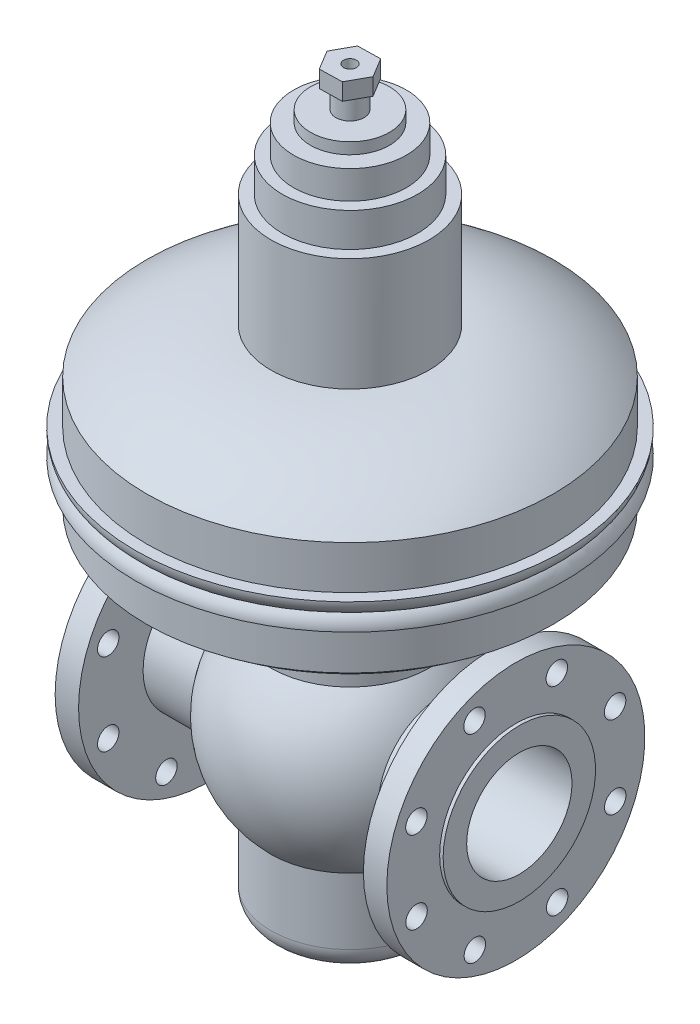
from build123d import *

# Parameters (mm, degrees)
SKETCH1_R                   = 57.15
BASE_EXTRUDE_DEPTH          = 150
BOSS_EXTRUDE1_DEPTH         = 400
BOSS_EXTRUDE1_DEPTH_BACK    = 150
SKETCH2_R                   = 70
FILLET1_R                   = 20
SHELL1_START                = -150
SHELL1_OUTLINE_R            = 46.65
SHELL1_DEPTH                = 300
SKETCH6_R                   = 60
BOSS_EXTRUDE2_DEPTH         = 30
SKETCH7_R                   = 50
BOSS_EXTRUDE3_DEPTH         = 25
SKETCH8_R                   = 35
BOSS_EXTRUDE4_DEPTH         = 10
SKETCH9_R                   = 12.5
BOSS_EXTRUDE5_DEPTH         = 35
BOSS_EXTRUDE6_DEPTH         = 15
CUT_EXTRUDE1_REACH          = 634.14
SKETCH14_R                  = 9.5
CIRPATTERN1_COUNT           = 8
CUT_EXTRUDE2_REACH          = 634.14
SKETCH15_R                  = 9.5
CIRPATTERN2_COUNT           = 8
F_1_2_20_TAPPED_HOLE1_D     = 11.50874
F_1_2_20_TAPPED_HOLE1_DEPTH = 31.75
F_1_2_20_TAPPED_HOLE1_TIP   = 3.45757432


with BuildPart() as part:
    # Sketch1 → Base-Extrude (new, symmetric)
    with BuildSketch(Plane(origin=(0, 0, 0), x_dir=(0, 0, -1), z_dir=(1, 0, 0))):
        Circle(SKETCH1_R)
    extrude(amount=BASE_EXTRUDE_DEPTH, both=True)

    # Sketch2 → Boss-Extrude1 (add, two sides: drawn at the far end of the back side and taken through both)
    with BuildSketch(Plane(origin=(0, 0, 0), x_dir=(1, 0, 0), z_dir=(0, 1, 0)).offset(-BOSS_EXTRUDE1_DEPTH_BACK)):
        with Locations(Location((0, 0, 0), (0, 0, 270))):
            Circle(SKETCH2_R)
    extrude(amount=BOSS_EXTRUDE1_DEPTH + BOSS_EXTRUDE1_DEPTH_BACK)

    # Sketch3 → Boss-Revolve1 (revolve)
    with BuildSketch(Plane.XY):
        with BuildLine():
            Line((0, -100), (0, 100))
            ThreePointArc((0, 100), (100, 0), (0, -100))
        make_face()
    revolve(axis=Axis((0, -115.862970753, 0), (0, 1, 0)))

    # Fillet1
    fillet1_edges = [part.edges().sort_by_distance(p)[0] for p in [
        (0, -150, -70),
    ]]
    fillet(fillet1_edges, radius=FILLET1_R)

    # Shell1: read off the stored shape, not the designer's step
    # Shell1 outline → Shell1 (cut)
    with BuildSketch(Plane.YZ.offset(SHELL1_START)):
        Circle(SHELL1_OUTLINE_R)
    extrude(amount=SHELL1_DEPTH, mode=Mode.SUBTRACT)

    # Shell1 2 outline → Shell1 2 (revolve, cut)
    with BuildSketch(Plane.XY):
        with BuildLine():
            Line((59.499999977, 66.858058621), (59.5, 389.5))
            Line((59.5, 389.5), (0, 389.5))
            Line((0, 389.5), (0, -139.5))
            Line((0, -139.5), (50, -139.5))
            ThreePointArc((50, -139.5), (56.717514421, -136.717514421), (59.5, -130))
            Line((59.5, -130), (59.499999977, -66.858058621))
            ThreePointArc((59.499999977, -66.858058621), (89.5, 0), (59.499999977, 66.858058621))
        make_face()
    revolve(axis=Axis((0, 0, 0), (0, 1, 0)), mode=Mode.SUBTRACT)

    # Sketch4 → Boss-Revolve2 (revolve)
    with BuildSketch(Plane.XY, mode=Mode.PRIVATE) as boss_revolve2_sk:
        with BuildLine():
            Line((70, 210), (180, 210))
            Line((180, 210), (180, 160))
            ThreePointArc((180, 160), (128.523499554, 130.310376228), (70, 120))
            Line((70, 120), (70, 210))
        make_face()
    revolve(boss_revolve2_sk.sketch.rotate(Axis((0, 0, 0), (0, 1, 0)), 90), axis=Axis((0, 0, 0), (0, 1, 0)))

    # Sketch5 → Boss-Revolve3 (revolve)
    with BuildSketch(Plane.XY, mode=Mode.PRIVATE) as boss_revolve3_sk:
        with BuildLine():
            Line((190, 198.380052899), (180, 198.380052899))
            Line((180, 198.380052899), (180, 210))
            Line((180, 210), (185, 210))
            ThreePointArc((185, 210), (188.696946821, 204.705066152), (190, 198.380052899))
        make_face()
    revolve(boss_revolve3_sk.sketch.rotate(Axis((0, 0, 0), (0, 1, 0)), 90), axis=Axis((0, 0, 0), (0, 1, 0)))

    # Mirror1: read off the stored shape, not the designer's step
    # Mirror1 outline → Mirror1 (revolve)
    with BuildSketch(Plane.XY):
        with BuildLine():
            Line((70, 210), (185, 210))
            ThreePointArc((185, 210), (188.696946821, 215.294933847), (190, 221.619947101))
            Line((190, 221.619947101), (180, 221.619947101))
            Line((180, 221.619947101), (180, 260))
            ThreePointArc((180, 260), (128.523499554, 289.689623772), (70, 300))
            Line((70, 300), (70, 210))
        make_face()
    revolve(axis=Axis((0, 0, 0), (0, 1, 0)))

    # Sketch6 → Boss-Extrude2 (add)
    with BuildSketch(Plane(origin=(0, 400, 0), x_dir=(-1, 0, 0), z_dir=(0, 1, 0))):
        with Locations(Location((0, 0, 0), (0, 0, 90))):
            Circle(SKETCH6_R)
    extrude(amount=BOSS_EXTRUDE2_DEPTH)

    # Sketch7 → Boss-Extrude3 (add)
    with BuildSketch(Plane(origin=(0, 430, 0), x_dir=(-1, 0, 0), z_dir=(0, 1, 0))):
        with Locations(Location((0, 0, 0), (0, 0, 90))):
            Circle(SKETCH7_R)
    extrude(amount=BOSS_EXTRUDE3_DEPTH)

    # Sketch8 → Boss-Extrude4 (add)
    with BuildSketch(Plane(origin=(0, 455, 0), x_dir=(-1, 0, 0), z_dir=(0, 1, 0))):
        with Locations(Location((0, 0, 0), (0, 0, 90))):
            Circle(SKETCH8_R)
    extrude(amount=BOSS_EXTRUDE4_DEPTH)

    # Sketch9 → Boss-Extrude5 (add)
    with BuildSketch(Plane(origin=(0, 465, 0), x_dir=(-1, 0, 0), z_dir=(0, 1, 0))):
        with Locations(Location((0, 0, 0), (0, 0, 90))):
            Circle(SKETCH9_R)
    extrude(amount=BOSS_EXTRUDE5_DEPTH)

    # hexagon2 → Boss-Extrude6 (add)
    with BuildSketch(Plane(origin=(-2.358099014, 500, -8.084910906), x_dir=(-1, 0, 0), z_dir=(0, 1, 0))):
        Polygon((17.63776533, 8.49161613), (7.287616102, 25.605190011), (-12.708248242, 25.198484787), (-22.353963358, 7.678205682), (-12.003814131, -9.435368198), (7.992050213, -9.028662974), align=None)
    extrude(amount=-BOSS_EXTRUDE6_DEPTH)

    # Sketch13 → Boss-Revolve4 (revolve)
    with BuildSketch(Plane.XY, mode=Mode.PRIVATE) as boss_revolve4_sk:
        Polygon((126.15, 57.15), (126.15, 114.3), (146.9, 114.3), (146.9, 67.5), (150, 67.5), (150, 57.15), align=None)
    boss_revolve4 = revolve(boss_revolve4_sk.sketch.rotate(Axis((0, 0, 0), (1, 0, 0)), 90), axis=Axis((0, 0, 0), (1, 0, 0)))

    # Mirror2: Boss-Revolve4 across plane
    add(boss_revolve4.mirror(Plane(origin=(0, 0, 0), x_dir=(0, 0, 1), z_dir=(1, 0, 0))))

    # Sketch14 → Cut-Extrude1 (cut, up to next)
    with BuildSketch(Plane(origin=(146.9, 0, 0), x_dir=(0, 0, -1), z_dir=(1, 0, 0)), mode=Mode.PRIVATE) as cut_extrude1_sk1:
        with Locations((-36.604129483, 87.93577318)):
            Circle(SKETCH14_R)
    cut_extrude1_tool1 = extrude(cut_extrude1_sk1.sketch, amount=-CUT_EXTRUDE1_REACH, mode=Mode.PRIVATE) & part.part
    cut_extrude1 = cut_extrude1_tool1.solids().sort_by_distance((146.9, 87.935773, 36.604129))[0]
    add(cut_extrude1, mode=Mode.SUBTRACT)

    # CirPattern1: Cut-Extrude1 ×8 about axis
    cirpattern1_axis = Axis((0, 0, 0), (1, 0, 0))
    for i in range(1, CIRPATTERN1_COUNT):
        add(cut_extrude1.rotate(cirpattern1_axis, i * 360 / CIRPATTERN1_COUNT), mode=Mode.SUBTRACT)

    # Sketch15 → Cut-Extrude2 (cut, up to next)
    with BuildSketch(Plane.ZY.offset(146.9), mode=Mode.PRIVATE) as cut_extrude2_sk1:
        with Locations((-36.450596933, 87.999525472)):
            Circle(SKETCH15_R)
    cut_extrude2_tool1 = extrude(cut_extrude2_sk1.sketch, amount=-CUT_EXTRUDE2_REACH, mode=Mode.PRIVATE) & part.part
    cut_extrude2 = cut_extrude2_tool1.solids().sort_by_distance((-146.9, 87.999525, -36.450597))[0]
    add(cut_extrude2, mode=Mode.SUBTRACT)

    # CirPattern2: Cut-Extrude2 ×8 about axis
    cirpattern2_axis = Axis((0, 0, 0), (1, 0, 0))
    for i in range(1, CIRPATTERN2_COUNT):
        add(cut_extrude2.rotate(cirpattern2_axis, i * 360 / CIRPATTERN2_COUNT), mode=Mode.SUBTRACT)

    # 1/2-20 Tapped Hole1
    with Locations(Plane(origin=(0, 500, 0), x_dir=(-1, 0, 0), z_dir=(0, 1, 0))):
        with Locations((0, 0)):
            Hole(F_1_2_20_TAPPED_HOLE1_D / 2, depth=F_1_2_20_TAPPED_HOLE1_DEPTH)
            with Locations((0, 0, -(F_1_2_20_TAPPED_HOLE1_DEPTH + F_1_2_20_TAPPED_HOLE1_TIP / 2))):  # 118° drill point
                Cone(0, F_1_2_20_TAPPED_HOLE1_D / 2, F_1_2_20_TAPPED_HOLE1_TIP, mode=Mode.SUBTRACT)


solid = part.part
